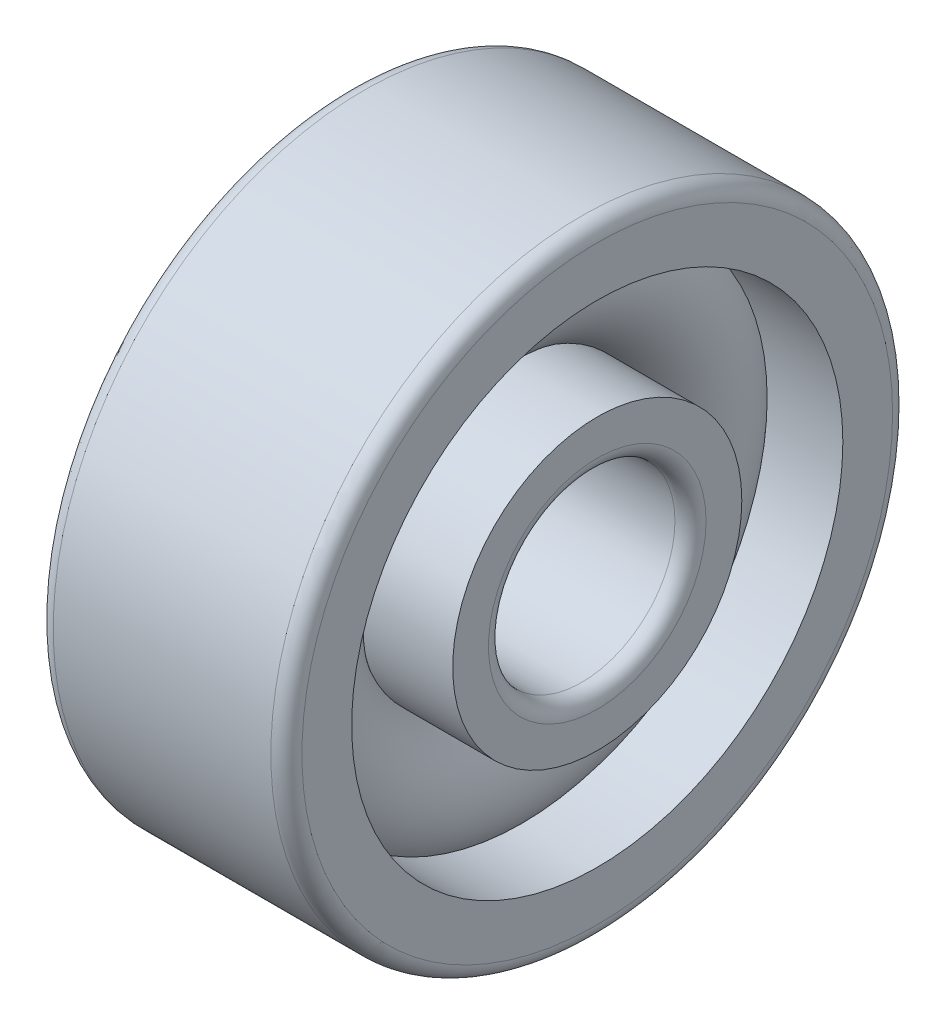
from build123d import *

# Parameters (mm, degrees)
CAGSPISKE_W     = 0.105
CAGSPISKE_H     = 0.07
CAGESPINE_ANGLE = 0.001
BALSIMSKE_R     = 0.21


with BuildPart() as part:
    # CagSpiSke → CageSpine (revolve)
    with BuildSketch(Plane.XY):
        with Locations((0, 0.65)):
            Rectangle(CAGSPISKE_W, CAGSPISKE_H)
    revolve(axis=Axis((-20.6375, 0, 0), (1, 0, 0)), revolution_arc=CAGESPINE_ANGLE)

    # BalSimSke → BallsSimplified (revolve)
    with BuildSketch(Plane.XY):
        with Locations((0, 0.65)):
            Circle(BALSIMSKE_R)
    revolve(axis=Axis((-10, 0, 0), (1, 0, 0)))

    # InnRacSke → InnerRace (revolve)
    with BuildSketch(Plane.XY):
        with BuildLine():
            Line((-0.120933866, 0.51), (-0.4, 0.51))
            Line((-0.4, 0.51), (-0.4, 0.35))
            ThreePointArc((-0.4, 0.35), (-0.385355339, 0.314644661), (-0.35, 0.3))
            Line((-0.35, 0.3), (0.35, 0.3))
            ThreePointArc((0.35, 0.3), (0.385355339, 0.314644661), (0.4, 0.35))
            Line((0.4, 0.35), (0.4, 0.465))
            Line((0.4, 0.465), (0, 0.465))
            ThreePointArc((0, 0.465), (-0.06451744, 0.476614591), (-0.120933866, 0.51))
        make_face()
    revolve(axis=Axis((-20.6375, 0, 0), (1, 0, 0)))

    # OutRacSke → OuterRace (revolve)
    with BuildSketch(Plane.XY):
        with BuildLine():
            Line((0, 0.835), (-0.4, 0.835))
            Line((-0.4, 0.835), (-0.4, 0.95))
            ThreePointArc((-0.4, 0.95), (-0.385355339, 0.985355339), (-0.35, 1))
            Line((-0.35, 1), (0.35, 1))
            ThreePointArc((0.35, 1), (0.385355339, 0.985355339), (0.4, 0.95))
            Line((0.4, 0.95), (0.4, 0.79))
            Line((0.4, 0.79), (0.120933866, 0.79))
            ThreePointArc((0.120933866, 0.79), (0.06451744, 0.823385409), (0, 0.835))
        make_face()
    revolve(axis=Axis((-20.6375, 0, 0), (1, 0, 0)))


solid = part.part
